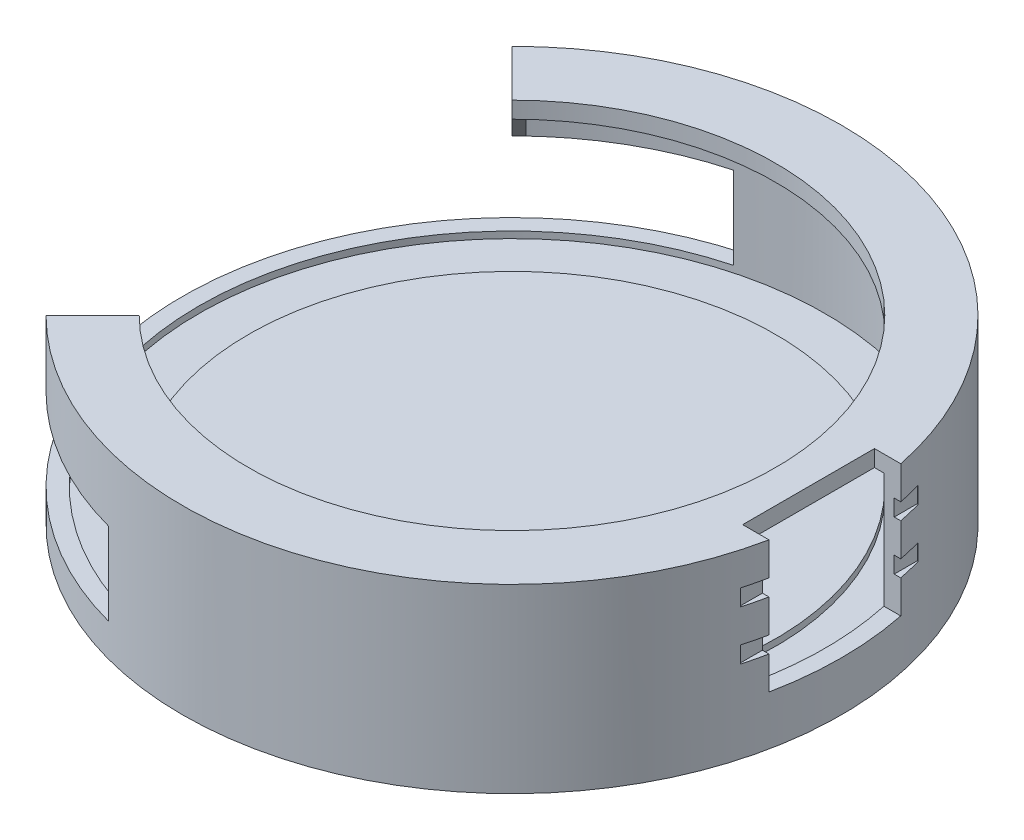
from build123d import *
from build123d.topology import SkipClean

# Parameters (mm, degrees)
SKETCH1_R            = 100
BOSS_EXTRUDE1_DEPTH  = 10
SKETCH2_R            = 95
SKETCH2_R_2          = 80
CUT_EXTRUDE1_DEPTH   = 2
BOSS_EXTRUDE2_DEPTH  = 40
BOSS_EXTRUDE3_DEPTH  = 5
CUT_EXTRUDE2_START   = -5
SKETCH5_W            = 50
SKETCH5_H            = 40
CUT_EXTRUDE2_DEPTH   = 40
BOSS_EXTRUDE4_START  = -45
BOSS_EXTRUDE4_DEPTH  = 45
SKETCH8_W            = 40
SKETCH8_H            = 5
BOSS_EXTRUDE5_DEPTH  = 55
CUT_EXTRUDE3_START   = -10
SKETCH10_W           = 8.429508811
SKETCH10_H           = 40
CUT_EXTRUDE3_DEPTH   = 10
BOSS_EXTRUDE6_START  = 18.2
BOSS_EXTRUDE6_DEPTH  = 2
BOSS_EXTRUDE7_START  = 18.1
BOSS_EXTRUDE7_DEPTH  = 15
SKETCH13_W           = 20.653307815
SKETCH13_H           = 40
CUT_EXTRUDE4_DEPTH   = 5
BOSS_EXTRUDE8_DEPTH  = 17
BOSS_EXTRUDE9_DEPTH  = 3
BOSS_EXTRUDE10_DEPTH = 3
SKETCH18_W           = 11.98170237
SKETCH18_H           = 40
CUT_EXTRUDE5_DEPTH   = 5
CUT_EXTRUDE6_START   = -20
CUT_EXTRUDE6_DEPTH   = 25
CUT_EXTRUDE7_START   = -200
CUT_EXTRUDE7_DEPTH   = 200
CUT_EXTRUDE8_DEPTH   = 40
CUT_EXTRUDE9_START   = 6
SKETCH23_W           = 7
SKETCH23_H           = 5
CUT_EXTRUDE9_DEPTH   = 40


with BuildPart() as part:
    # Sketch1 → Boss-Extrude1 (new body)
    with BuildSketch(Plane(origin=(0, 0, 0), x_dir=(1, 0, 0), z_dir=(0, 1, 0))):
        with Locations(Location((0, 0, 0), (0, 0, 270))):
            Circle(SKETCH1_R)
    extrude(amount=BOSS_EXTRUDE1_DEPTH)

    # Sketch2 → Cut-Extrude1 (cut)
    with BuildSketch(Plane(origin=(0, 10, 0), x_dir=(1, 0, 0), z_dir=(0, 1, 0))):
        with Locations(Location((0, 0, 0), (0, 0, 270))):
            Circle(SKETCH2_R)
        with Locations(Location((0, 0, 0), (0, 0, 270))):
            Circle(SKETCH2_R_2, mode=Mode.SUBTRACT)
    extrude(amount=-CUT_EXTRUDE1_DEPTH, mode=Mode.SUBTRACT)

    # Sketch3 → Boss-Extrude2 (add)
    with SkipClean():  # the faces are left unmerged after this step: merging them gives an invalid solid
        with BuildSketch(Plane(origin=(0, 10, 0), x_dir=(1, 0, 0), z_dir=(0, 1, 0))):
            with BuildLine():
                Line((-67.175144213, 67.175144213), (-70.710678119, 70.710678119))
                ThreePointArc((-70.710678119, 70.710678119), (100, 0), (-70.710678119, -70.710678119))
                Line((-70.710678119, -70.710678119), (-67.175144213, -67.175144213))
                ThreePointArc((-67.175144213, -67.175144213), (95, 0), (-67.175144213, 67.175144213))
            make_face()
        extrude(amount=BOSS_EXTRUDE2_DEPTH)

    # Sketch5 → Cut-Extrude2 (cut)
    with SkipClean():  # the faces are left unmerged after this step: merging them gives an invalid solid
        with BuildSketch(Plane(origin=(0, 55, 0), x_dir=(1, 0, 0), z_dir=(0, 1, 0)).offset(CUT_EXTRUDE2_START)):
            with Locations((102.459666924, 0)):
                Rectangle(SKETCH5_W, SKETCH5_H)
        extrude(amount=-CUT_EXTRUDE2_DEPTH, mode=Mode.SUBTRACT)



with BuildPart() as body_2:
    # Sketch4 → Boss-Extrude3 (new body)
    with BuildSketch(Plane(origin=(0, 50, 0), x_dir=(1, 0, 0), z_dir=(0, 1, 0))):
        with BuildLine():
            ThreePointArc((-67.175144213, -67.175144213), (95, 0), (-67.175144213, 67.175144213))
            Line((-67.175144213, 67.175144213), (-56.568542495, 56.568542495))
            ThreePointArc((-56.568542495, 56.568542495), (30.614674589, 73.910362601), (80, 0))
            ThreePointArc((80, 0), (30.614674589, -73.910362601), (-56.568542495, -56.568542495))
            Line((-56.568542495, -56.568542495), (-67.175144213, -67.175144213))
        make_face()
        with BuildLine():
            Line((-70.710678119, 70.710678119), (-67.175144213, 67.175144213))
            ThreePointArc((-67.175144213, 67.175144213), (95, 0), (-67.175144213, -67.175144213))
            Line((-67.175144213, -67.175144213), (-70.710678119, -70.710678119))
            ThreePointArc((-70.710678119, -70.710678119), (100, 0), (-70.710678119, 70.710678119))
        make_face()
    extrude(amount=BOSS_EXTRUDE3_DEPTH)


with BuildPart() as part_1:
    with SkipClean():  # the faces are left unmerged after this step: merging them gives an invalid solid
        add(part.part)

        add(body_2.part)  # Boss-Extrude4 merges body 2
        # Sketch7 → Boss-Extrude4 (add)
        with BuildSketch(Plane(origin=(0, 55, 0), x_dir=(1, 0, 0), z_dir=(0, 1, 0)).offset(BOSS_EXTRUDE4_START)):
            with BuildLine():
                ThreePointArc((96.824583655, 25), (97.434164903, 22.507410108), (97.979589711, 20))
                Line((97.979589711, 20), (127.459666924, 20))
                Line((127.459666924, 20), (127.459666924, -20))
                Line((127.459666924, -20), (97.979589711, -20))
                ThreePointArc((97.979589711, -20), (97.434164903, -22.507410108), (96.824583655, -25))
                Line((96.824583655, -25), (132.459666924, -25))
                Line((132.459666924, -25), (132.459666924, 25))
                Line((132.459666924, 25), (96.824583655, 25))
            make_face()
        extrude(amount=BOSS_EXTRUDE4_DEPTH)

    # Sketch8 → Boss-Extrude5 (add)
    with SkipClean():  # the faces are left unmerged after this step: merging them gives an invalid solid
        with BuildSketch(Plane.ZY.offset(-127.459666924)):
            with Locations((0, 12.5)):
                Rectangle(SKETCH8_W, SKETCH8_H)
        extrude(amount=BOSS_EXTRUDE5_DEPTH)

    # Sketch10 → Cut-Extrude3 (cut)
    with SkipClean():  # the faces are left unmerged after this step: merging them gives an invalid solid
        with BuildSketch(Plane.XZ.offset(CUT_EXTRUDE3_START)):
            with Locations((88.6561237, 0)):
                Rectangle(SKETCH10_W, SKETCH10_H)
            with BuildLine():
                Line((92.870878105, -20), (92.870878105, 20))
                ThreePointArc((92.870878105, 20), (95, 0), (92.870878105, -20))
            make_face()
        extrude(amount=-CUT_EXTRUDE3_DEPTH, mode=Mode.SUBTRACT)

    # Sketch13 → Cut-Extrude4 (cut)
    with SkipClean():  # the faces are left unmerged after this step: merging them gives an invalid solid
        with BuildSketch(Plane(origin=(0, 55, 0), x_dir=(1, 0, 0), z_dir=(0, 1, 0))):
            with Locations((100.326653908, 0)):
                Rectangle(SKETCH13_W, SKETCH13_H)
        extrude(amount=-CUT_EXTRUDE4_DEPTH, mode=Mode.SUBTRACT)



with BuildPart() as body_2_2:
    # Sketch11 → Boss-Extrude6 (new body)
    with BuildSketch(Plane(origin=(0, 15, 0), x_dir=(1, 0, 0), z_dir=(0, 1, 0)).offset(BOSS_EXTRUDE6_START)):
        with BuildLine():
            Line((110.459666924, 8), (95.459666924, 8))
            Line((95.459666924, 8), (95.459666924, 3.5))
            Line((95.459666924, 3.5), (100.359666924, 3.5))
            ThreePointArc((100.359666924, 3.5), (103.859666924, 0), (100.359666924, -3.5))
            Line((100.359666924, -3.5), (95.459666924, -3.5))
            Line((95.459666924, -3.5), (95.459666924, -8))
            Line((95.459666924, -8), (110.459666924, -8))
            Line((110.459666924, -8), (110.459666924, 8))
        make_face()
    extrude(amount=BOSS_EXTRUDE6_DEPTH)

    # Sketch12 → Boss-Extrude7 (add)
    with BuildSketch(Plane(origin=(0, 15, 0), x_dir=(1, 0, 0), z_dir=(0, 1, 0)).offset(BOSS_EXTRUDE7_START)):
        Polygon((95.459666924, -10), (95.459666924, -8), (110.459666924, -8), (110.459666924, 8), (95.459666924, 8), (95.459666924, 10), (112.459666924, 10), (112.459666924, -10), align=None)
    extrude(amount=BOSS_EXTRUDE7_DEPTH)


with BuildPart() as part_2:
    with SkipClean():  # the faces are left unmerged after this step: merging them gives an invalid solid
        add(part_1.part)

        add(body_2_2.part)  # Boss-Extrude8 merges body 2 2
        # Sketch15 → Boss-Extrude8 (add)
        with BuildSketch(Plane(origin=(112.459666924, 0, 0), x_dir=(0, 0, -1), z_dir=(1, 0, 0))):
            Polygon((-8.249409199, 33.1), (-18.249409392, 15), (-20, 15), (-20, 15.967177607), (-10, 34.067177257), align=None)
            Polygon((10, 34.067177257), (20, 15.967177607), (20, 15), (18.249409392, 15), (8.249409199, 33.1), align=None)
        extrude(amount=-BOSS_EXTRUDE8_DEPTH)

    # Sketch16 → Boss-Extrude9 (add)
    with BuildSketch(Plane(origin=(0, 0, 0), x_dir=(0.7071067811865464, 0, 0.7071067811865487), z_dir=(-0.7071067811865487, 0, 0.7071067811865464))):
        Polygon((-80, 50), (-95, 35), (-95, 50), align=None)
    extrude(amount=-BOSS_EXTRUDE9_DEPTH)

    # Sketch17 → Boss-Extrude10 (add)
    with BuildSketch(Plane(origin=(0, 0, 0), x_dir=(-0.7071067811865475, 0, 0.7071067811865477), z_dir=(-0.7071067811865477, 0, -0.7071067811865475))):
        Polygon((80, 50), (95, 35), (95, 50), align=None)
    extrude(amount=-BOSS_EXTRUDE10_DEPTH)

    # Sketch18 → Cut-Extrude5 (cut)
    with BuildSketch(Plane(origin=(0, 15, 0), x_dir=(1, 0, 0), z_dir=(0, 1, 0))):
        with Locations((78.450518109, 0)):
            Rectangle(SKETCH18_W, SKETCH18_H)
    extrude(amount=-CUT_EXTRUDE5_DEPTH, mode=Mode.SUBTRACT)

    # Sketch20 → Cut-Extrude6 (cut)
    with BuildSketch(Plane(origin=(0, 55, 0), x_dir=(1, 0, 0), z_dir=(0, 1, 0)).offset(CUT_EXTRUDE6_START)):
        with BuildLine():
            Line((0, 0), (-31.757481462, 118.520534337))
            ThreePointArc((-31.757481462, 118.520534337), (-122.701486088, 0), (-31.757481462, -118.520534337))
            Line((-31.757481462, -118.520534337), (0, 0))
        make_face()
    extrude(amount=-CUT_EXTRUDE6_DEPTH, mode=Mode.SUBTRACT)

    # Sketch21 → Cut-Extrude7 (cut)
    with BuildSketch(Plane(origin=(0, 55, 0), x_dir=(1, 0, 0), z_dir=(0, 1, 0)).offset(CUT_EXTRUDE7_START)):
        with BuildLine():
            Line((96.824583655, 25), (132.459666924, 25))
            Line((132.459666924, 25), (132.459666924, -25))
            Line((132.459666924, -25), (96.824583655, -25))
            ThreePointArc((96.824583655, -25), (100, 0), (96.824583655, 25))
        make_face()
    extrude(amount=CUT_EXTRUDE7_DEPTH, mode=Mode.SUBTRACT)

    # Sketch22 → Cut-Extrude8 (cut)
    with BuildSketch(Plane(origin=(0, 55, 0), x_dir=(1, 0, 0), z_dir=(0, 1, 0))):
        Polygon((95.459666924, 20), (95.459666924, -20), (121.621169639, -20), (97.979589711, 20), align=None)
    extrude(amount=-CUT_EXTRUDE8_DEPTH, mode=Mode.SUBTRACT)

    # Sketch23 → Cut-Extrude9 (cut)
    with SkipClean():  # the faces are left unmerged after this step: merging them gives an invalid solid
        with BuildSketch(Plane(origin=(90, 0, 0), x_dir=(0, 0, -1), z_dir=(1, 0, 0)).offset(CUT_EXTRUDE9_START)):
            with Locations((-23.5, 42.5)):
                Rectangle(SKETCH23_W, SKETCH23_H)
            with Locations((-23.5, 27.5)):
                Rectangle(SKETCH23_W, SKETCH23_H)
            with Locations((23.5, 27.5)):
                Rectangle(SKETCH23_W, SKETCH23_H)
            with Locations((23.5, 42.5)):
                Rectangle(SKETCH23_W, SKETCH23_H)
        extrude(amount=CUT_EXTRUDE9_DEPTH, mode=Mode.SUBTRACT)


solid = part_2.part
